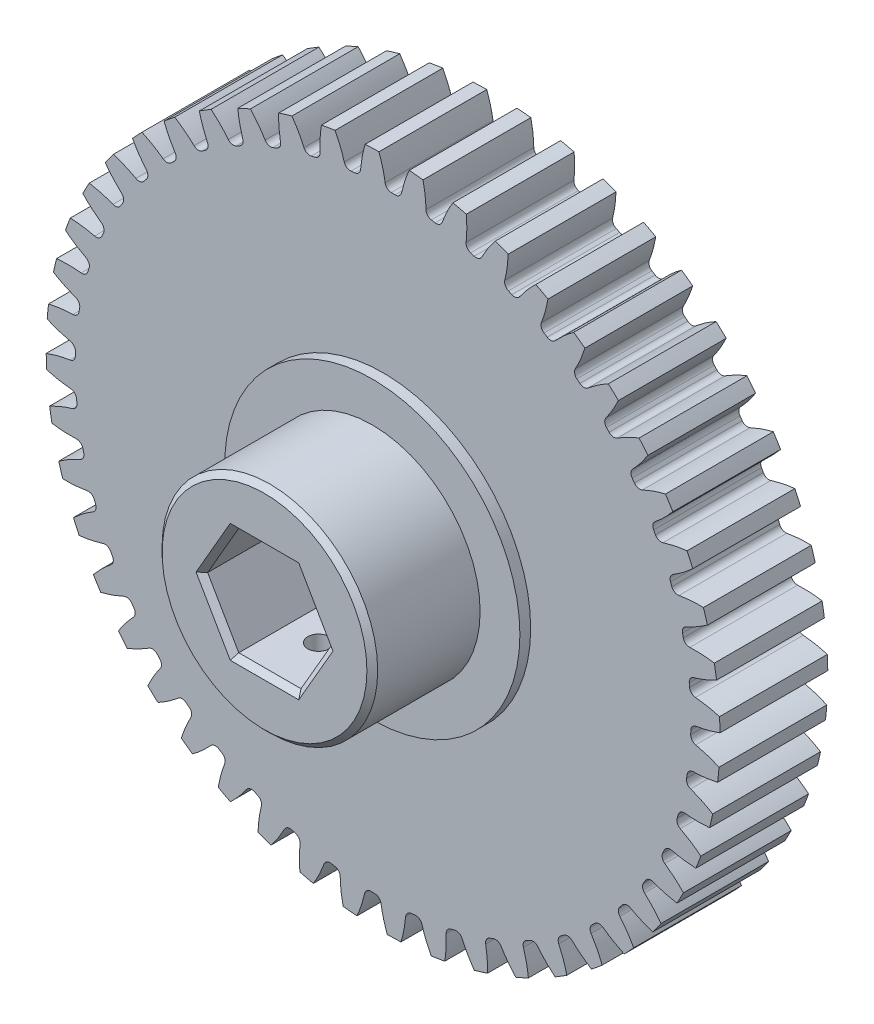
from build123d import *

# Parameters (mm, degrees)
SKETCH1_R                 = 39.6875
BOSS_EXTRUDE1_DEPTH       = 12.7
CUT_EXTRUDE1_DEPTH        = 58.545506449
FILLET1_R                 = 0.7480935
CIRPATTERN1_START         = -12.7
CIRPATTERN1_DEPTH         = 12.7
SKETCH6_R                 = 12.7
BOSS_EXTRUDE2_DEPTH       = 8.89
BOSS_EXTRUDE3_START       = 13.97
SKETCH7_R                 = 12.7
BOSS_EXTRUDE3_DEPTH       = 13.97
CUT_EXTRUDE3_DEPTH        = 12.7
M3X0_5_TAPPED_HOLE1_D     = 2.5
M3X0_5_TAPPED_HOLE1_DEPTH = 10.6700066
M3X0_5_TAPPED_HOLE1_TIP   = 0.751075774
CHAMFER1_SIZE             = 0.635
BOSS_EXTRUDE4_START       = 1.27
SKETCH11_R                = 17.3863
SKETCH11_R_2              = 12.7
BOSS_EXTRUDE4_DEPTH       = 1.27
SKETCH12_R                = 17.3863
SKETCH12_R_2              = 12.7
BOSS_EXTRUDE5_DEPTH       = 1.27


# Read off the part's stored shape, not the designer's step: CirPattern1
with BuildPart() as part:
    # Sketch1 → Boss-Extrude1 (new body)
    with BuildSketch(Plane.XY):
        Circle(SKETCH1_R)
    extrude(amount=-BOSS_EXTRUDE1_DEPTH)

    # Sketch4 → Cut-Extrude1 (cut, through all)
    with BuildSketch(Plane.XY):
        with BuildLine():
            Line((0.240718922, 36.88563963), (0.240718922, 36.262463534))
            ThreePointArc((0.240718922, 36.262463534), (1.186503463, 36.243846604), (2.131480605, 36.20056626))
            Line((2.131480605, 36.20056626), (2.172238367, 36.822408083))
            add(Edge.make_bspline(
                [(6.893954828, 44.735686784), (3.179844428, 41.34985308), (2.172238367, 36.822408083)],
                knots=[0, 0, 0, 1, 1, 1], degree=2))
            ThreePointArc((6.893954828, 44.735686784), (1.480992288, 45.23952859), (-3.953333536, 45.090791068))
            add(Edge.make_bspline(
                [(-3.953333536, 45.090791068), (-0.468620005, 41.469291718), (0.240718922, 36.88563963)],
                knots=[0, 0, 0, 1, 1, 1], degree=2))
        make_face()
    extrude(amount=-CUT_EXTRUDE1_DEPTH, mode=Mode.SUBTRACT)

    # Fillet1
    # the kernel refuses this fillet: 0.7480935 mm, written as the material it adds along each edge
    with BuildSketch(Plane(origin=(2.131480605, 36.20056626, 0), x_dir=(-0.9988052902028769, 0.0488670877252457, 0), z_dir=(0, 0, -1))) as fillet1_piece_1:
        with BuildLine():
            CenterArc((0.727260644, 0.748056652), FILLET1_R, 189.616112264, 79.815209924)
            Line((-0.010321469, 0.623090615), (-0.025073112, 0.620591294))
            ThreePointArc((-0.025073112, 0.620591294), (-0.020120552, 0.311297499), (-0.014959818, -0.000247809))
            Line((-0.014959818, -0.000247809), (0.000148499, -0.014961133))
            ThreePointArc((0.000148499, -0.014961133), (0.359917857, -0.013175709), (0.719687215, -0.014961133))
            Line((0.719687215, -0.014961133), (0.719835714, 0))
        make_face()
    extrude(amount=12.7)
    with BuildSketch(Plane(origin=(0.240718922, 36.262463534, 0), x_dir=(0, 1, 0), z_dir=(0, 0, -1))) as fillet1_piece_2:
        with BuildLine():
            CenterArc((0.735908652, 0.739550712), FILLET1_R, 181.51769315, 79.815209924)
            Line((-0.011922412, 0.719736973), (-0.026879033, 0.719340698))
            ThreePointArc((-0.026879033, 0.719340698), (-0.019135108, 0.359650261), (-0.01496154, -9.9318e-05))
            Line((-0.01496154, -9.9318e-05), (0, -0.01496187))
            ThreePointArc((0, -0.01496187), (0.311588048, -0.01496187), (0.620921445, -0.014791014))
            Line((0.620921445, -0.014791014), (0.623176097, 0))
        make_face()
    extrude(amount=12.7)

    # CirPattern1 outline → CirPattern1 (cut)
    with BuildSketch(Plane.XY.offset(CIRPATTERN1_START)):
        with BuildLine():
            ThreePointArc((-2.112500539, 39.631237651), (-3.890052234, 39.496394138), (-5.65975547, 39.28186381))
            add(Edge.make_bspline(
                [(-5.65975547, 39.28186381), (-4.986888308, 38.00730371), (-4.57588255, 36.601497994)],
                knots=[0.684219953, 0.684219953, 0.684219953, 1, 1, 1], degree=2))
            ThreePointArc((-4.57588255, 36.601497994), (-4.274892959, 36.189054339), (-3.779406036, 36.065777368))
            ThreePointArc((-3.779406036, 36.065777368), (-3.554418528, 36.088645251), (-3.329292785, 36.110109619))
            ThreePointArc((-3.329292785, 36.110109619), (-2.867376615, 36.327682491), (-2.652634149, 36.79092128))
            add(Edge.make_bspline(
                [(-2.652634149, 36.79092128), (-2.523784618, 38.249898059), (-2.112500539, 39.631237651)],
                knots=[0, 0, 0, 0.315780047, 0.315780047, 0.315780047], degree=2))
        make_face()
        with BuildLine():
            add(Edge.make_bspline(
                [(6.959943282, 36.223853275), (7.462013348, 37.599767913), (8.216800257, 38.827591347)],
                knots=[0, 0, 0, 0.315780047, 0.315780047, 0.315780047], degree=2))
            ThreePointArc((8.216800257, 38.827591347), (6.464917097, 39.157406747), (4.699990502, 39.408219263))
            add(Edge.make_bspline(
                [(4.699990502, 39.408219263), (5.020049844, 38.002937911), (5.053201627, 36.538657746)],
                knots=[0.684219953, 0.684219953, 0.684219953, 1, 1, 1], degree=2))
            ThreePointArc((5.053201627, 36.538657746), (5.237186973, 36.062365929), (5.683884161, 35.815048066))
            ThreePointArc((5.683884161, 35.815048066), (5.90712405, 35.778905693), (6.130134206, 35.741371851))
            ThreePointArc((6.130134206, 35.741371851), (6.632622967, 35.831978404), (6.959943282, 36.223853275))
        make_face()
        with BuildLine():
            add(Edge.make_bspline(
                [(11.628561638, 35.005498294), (12.305929324, 36.304108497), (13.214522043, 37.422908271)],
                knots=[0, 0, 0, 0.315780047, 0.315780047, 0.315780047], degree=2))
            ThreePointArc((13.214522043, 37.422908271), (11.520676035, 37.978568692), (9.803586234, 38.45760462))
            add(Edge.make_bspline(
                [(9.803586234, 38.45760462), (9.9374814, 37.022569518), (9.779222651, 35.566489297)],
                knots=[0.684219953, 0.684219953, 0.684219953, 1, 1, 1], degree=2))
            ThreePointArc((9.779222651, 35.566489297), (9.89946542, 35.070257316), (10.310059592, 34.766749609))
            ThreePointArc((10.310059592, 34.766749609), (10.526672107, 34.701777786), (10.742875231, 34.635456384))
            ThreePointArc((10.742875231, 34.635456384), (11.25289166, 34.659699841), (11.628561638, 35.005498294))
        make_face()
        with BuildLine():
            add(Edge.make_bspline(
                [(16.09821208, 33.188189531), (16.939287436, 34.38727572), (17.986139693, 35.377908858)],
                knots=[0, 0, 0, 0.315780047, 0.315780047, 0.315780047], degree=2))
            ThreePointArc((17.986139693, 35.377908858), (16.379313011, 36.149906796), (14.739439888, 36.8489697))
            add(Edge.make_bspline(
                [(14.739439888, 36.8489697), (14.684879895, 35.408734696), (14.337918464, 33.985768355)],
                knots=[0.684219953, 0.684219953, 0.684219953, 1, 1, 1], degree=2))
            ThreePointArc((14.337918464, 33.985768355), (14.392361268, 33.478086876), (14.759827045, 33.123582426))
            ThreePointArc((14.759827045, 33.123582426), (14.966105885, 33.03089284), (15.171802681, 32.936918656))
            ThreePointArc((15.171802681, 32.936918656), (15.680620254, 32.894384205), (16.09821208, 33.188189531))
        make_face()
        with BuildLine():
            add(Edge.make_bspline(
                [(20.29241765, 30.803021645), (21.282809645, 31.882067121), (22.450009507, 32.727583617)],
                knots=[0, 0, 0, 0.315780047, 0.315780047, 0.315780047], degree=2))
            ThreePointArc((22.450009507, 32.727583617), (20.9576954, 33.702709973), (19.423097638, 34.609838691))
            add(Edge.make_bspline(
                [(19.423097638, 34.609838691), (19.181016023, 33.189046607), (18.651288517, 31.823541494)],
                knots=[0.684219953, 0.684219953, 0.684219953, 1, 1, 1], degree=2))
            ThreePointArc((18.651288517, 31.823541494), (18.638999825, 31.313097089), (18.957049766, 30.913661565))
            ThreePointArc((18.957049766, 30.913661565), (19.149465443, 30.794840159), (19.341136382, 30.674821118))
            ThreePointArc((19.341136382, 30.674821118), (19.84004909, 30.566236534), (20.29241765, 30.803021645))
        make_face()
        with BuildLine():
            add(Edge.make_bspline(
                [(24.139414328, 27.890805518), (25.262177079, 28.831347515), (26.529753433, 29.517280346)],
                knots=[0, 0, 0, 0.315780047, 0.315780047, 0.315780047], degree=2))
            ThreePointArc((26.529753433, 29.517280346), (25.177485811, 30.678850439), (23.774420802, 31.778523747))
            add(Edge.make_bspline(
                [(23.774420802, 31.778523747), (23.348959648, 30.401484728), (22.645529852, 29.116805014)],
                knots=[0.684219953, 0.684219953, 0.684219953, 1, 1, 1], degree=2))
            ThreePointArc((22.645529852, 29.116805014), (22.566719928, 28.612331528), (22.829912108, 28.174799383))
            ThreePointArc((22.829912108, 28.174799383), (23.005172337, 28.031879225), (23.179537876, 27.887868886))
            ThreePointArc((23.179537876, 27.887868886), (23.660009185, 27.715092082), (24.139414328, 27.890805518))
        make_face()
        with BuildLine():
            add(Edge.make_bspline(
                [(27.573378934, 24.501369976), (28.80930166, 25.287315559), (30.155565923, 25.801928224)],
                knots=[0, 0, 0, 0.315780047, 0.315780047, 0.315780047], degree=2))
            ThreePointArc((30.155565923, 25.801928224), (28.966482459, 27.130067267), (27.718957035, 28.403469451))
            add(Edge.make_bspline(
                [(27.718957035, 28.403469451), (27.117396101, 27.093745016), (26.252299893, 25.911871929)],
                knots=[0.684219953, 0.684219953, 0.684219953, 1, 1, 1], degree=2))
            ThreePointArc((26.252299893, 25.911871929), (26.108317195, 25.422001043), (26.312148326, 24.953858572))
            ThreePointArc((26.312148326, 24.953858572), (26.467254355, 24.789285066), (26.621331051, 24.623747485))
            ThreePointArc((26.621331051, 24.623747485), (27.075139963, 24.389734721), (27.573378934, 24.501369976))
        make_face()
        with BuildLine():
            add(Edge.make_bspline(
                [(30.535555382, 20.6927092), (31.863491102, 21.310610622), (33.26540832, 21.645097957)],
                knots=[0, 0, 0, 0.315780047, 0.315780047, 0.315780047], degree=2))
            ThreePointArc((33.26540832, 21.645097957), (32.25985456, 23.117081123), (31.189214228, 24.542423918))
            add(Edge.make_bspline(
                [(31.189214228, 24.542423918), (30.421846388, 23.322423816), (29.409885805, 22.26357953)],
                knots=[0.684219953, 0.684219953, 0.684219953, 1, 1, 1], degree=2))
            ThreePointArc((29.409885805, 22.26357953), (29.203193917, 21.796693071), (29.34417639, 21.305950323))
            ThreePointArc((29.34417639, 21.305950323), (29.476474312, 21.122539366), (29.607625871, 20.938306938))
            ThreePointArc((29.607625871, 20.938306938), (30.02700759, 20.647062236), (30.535555382, 20.6927092))
        make_face()
        with BuildLine():
            add(Edge.make_bspline(
                [(32.975260012, 16.529990433), (34.372487377, 16.96927523), (35.806070357, 17.117914063)],
                knots=[0, 0, 0, 0.315780047, 0.315780047, 0.315780047], degree=2))
            ThreePointArc((35.806070357, 17.117914063), (35.001251607, 18.708555312), (34.125815318, 20.261450707))
            add(Edge.make_bspline(
                [(34.125815318, 20.261450707), (33.205770449, 19.152049477), (32.064260416, 18.234351113)],
                knots=[0.684219953, 0.684219953, 0.684219953, 1, 1, 1], degree=2))
            ThreePointArc((32.064260416, 18.234351113), (31.798395894, 17.798437637), (31.87411746, 17.293491356))
            ThreePointArc((31.87411746, 17.293491356), (31.981343622, 17.094381162), (32.087326004, 16.894606154))
            ThreePointArc((32.087326004, 16.894606154), (32.465104792, 16.551112792), (32.975260012, 16.529990433))
        make_face()
        with BuildLine():
            add(Edge.make_bspline(
                [(34.8507488, 12.084438946), (36.293360863, 12.337590834), (37.734080602, 12.297837913)],
                knots=[0, 0, 0, 0.315780047, 0.315780047, 0.315780047], degree=2))
            ThreePointArc((37.734080602, 12.297837913), (37.143767534, 13.979920933), (36.478514247, 15.633798458))
            add(Edge.make_bspline(
                [(36.478514247, 15.633798458), (35.421534571, 14.653978263), (34.170006641, 13.893127893)],
                knots=[0.684219953, 0.684219953, 0.684219953, 1, 1, 1], degree=2))
            ThreePointArc((34.170006641, 13.893127893), (33.849518502, 13.495646001), (33.858683544, 12.985135958))
            ThreePointArc((33.858683544, 12.985135958), (33.939003275, 12.773733356), (34.018003092, 12.561833974))
            ThreePointArc((34.018003092, 12.561833974), (34.34771505, 12.171969219), (34.8507488, 12.084438946))
        make_face()
        with BuildLine():
            add(Edge.make_bspline(
                [(36.129931613, 7.432119359), (37.593244882, 7.494806837), (39.016450267, 7.267342347)],
                knots=[0, 0, 0, 0.315780047, 0.315780047, 0.315780047], degree=2))
            ThreePointArc((39.016450267, 7.267342347), (38.6507433, 9.01208623), (38.207055683, 10.738647582))
            add(Edge.make_bspline(
                [(38.207055683, 10.738647582), (37.031226416, 9.905173417), (35.69109458, 9.314189403)],
                knots=[0.684219953, 0.684219953, 0.684219953, 1, 1, 1], degree=2))
            ThreePointArc((35.69109458, 9.314189403), (35.321466463, 8.96194012), (35.263918164, 8.454601283))
            ThreePointArc((35.263918164, 8.454601283), (35.315957172, 8.234523431), (35.366622715, 8.014125333))
            ThreePointArc((35.366622715, 8.014125333), (35.642626379, 7.584559878), (36.129931613, 7.432119359))
        make_face()
        with BuildLine():
            add(Edge.make_bspline(
                [(36.79092128, 2.652634149), (38.249898059, 2.523784618), (39.631237651, 2.112500539)],
                knots=[0, 0, 0, 0.315780047, 0.315780047, 0.315780047], degree=2))
            ThreePointArc((39.631237651, 2.112500539), (39.496394132, 3.890052234), (39.281863803, 5.659755469))
            add(Edge.make_bspline(
                [(39.281863803, 5.659755469), (38.00730371, 4.986888308), (36.601497994, 4.57588255)],
                knots=[0.684219953, 0.684219953, 0.684219953, 1, 1, 1], degree=2))
            ThreePointArc((36.601497994, 4.57588255), (36.189054339, 4.274892959), (36.065777368, 3.779406036))
            ThreePointArc((36.065777368, 3.779406036), (36.088645251, 3.554418528), (36.110109619, 3.329292785))
            ThreePointArc((36.110109619, 3.329292785), (36.327682491, 2.867376615), (36.79092128, 2.652634149))
        make_face()
        with BuildLine():
            add(Edge.make_bspline(
                [(36.822408083, -2.172238367), (38.252084875, -2.490420255), (39.56792357, -3.07848674)],
                knots=[0, 0, 0, 0.315780047, 0.315780047, 0.315780047], degree=2))
            ThreePointArc((39.56792357, -3.07848674), (39.666250711, -1.298541635), (39.684548343, 0.484023371))
            add(Edge.make_bspline(
                [(39.684548343, 0.484023371), (38.3330655, -0.016723843), (36.88563963, -0.240718922)],
                knots=[0.684219953, 0.684219953, 0.684219953, 1, 1, 1], degree=2))
            ThreePointArc((36.88563963, -0.240718922), (36.437437463, -0.485298806), (36.250541122, -0.960455895))
            ThreePointArc((36.250541122, -0.960455895), (36.243846604, -1.186503463), (36.235742535, -1.412504886))
            ThreePointArc((36.235742535, -1.412504886), (36.391161882, -1.898868257), (36.822408083, -2.172238367))
        make_face()
        with BuildLine():
            add(Edge.make_bspline(
                [(36.223853275, -6.959943282), (37.599767913, -7.462013348), (38.827591347, -8.216800257)],
                knots=[0, 0, 0, 0.315780047, 0.315780047, 0.315780047], degree=2))
            ThreePointArc((38.827591347, -8.216800257), (39.157406742, -6.464917096), (39.408219258, -4.699990501))
            add(Edge.make_bspline(
                [(39.408219258, -4.699990501), (38.002937911, -5.020049844), (36.538657746, -5.053201627)],
                knots=[0.684219953, 0.684219953, 0.684219953, 1, 1, 1], degree=2))
            ThreePointArc((36.538657746, -5.053201627), (36.062365929, -5.237186973), (35.815048066, -5.683884161))
            ThreePointArc((35.815048066, -5.683884161), (35.778905693, -5.90712405), (35.741371851, -6.130134206))
            ThreePointArc((35.741371851, -6.130134206), (35.831978404, -6.632622967), (36.223853275, -6.959943282))
        make_face()
        with BuildLine():
            add(Edge.make_bspline(
                [(35.005498294, -11.628561638), (36.304108497, -12.305929324), (37.422908271, -13.214522043)],
                knots=[0, 0, 0, 0.315780047, 0.315780047, 0.315780047], degree=2))
            ThreePointArc((37.422908271, -13.214522043), (37.978568688, -11.520676033), (38.457604616, -9.803586233))
            add(Edge.make_bspline(
                [(38.457604616, -9.803586233), (37.022569518, -9.9374814), (35.566489297, -9.779222651)],
                knots=[0.684219953, 0.684219953, 0.684219953, 1, 1, 1], degree=2))
            ThreePointArc((35.566489297, -9.779222651), (35.070257316, -9.89946542), (34.766749609, -10.310059592))
            ThreePointArc((34.766749609, -10.310059592), (34.701777786, -10.526672107), (34.635456384, -10.742875231))
            ThreePointArc((34.635456384, -10.742875231), (34.659699841, -11.25289166), (35.005498294, -11.628561638))
        make_face()
        with BuildLine():
            add(Edge.make_bspline(
                [(33.188189531, -16.09821208), (34.38727572, -16.939287436), (35.377908858, -17.986139693)],
                knots=[0, 0, 0, 0.315780047, 0.315780047, 0.315780047], degree=2))
            ThreePointArc((35.377908858, -17.986139693), (36.149906794, -16.37931301), (36.848969696, -14.739439886))
            add(Edge.make_bspline(
                [(36.848969696, -14.739439886), (35.408734696, -14.684879895), (33.985768355, -14.337918464)],
                knots=[0.684219953, 0.684219953, 0.684219953, 1, 1, 1], degree=2))
            ThreePointArc((33.985768355, -14.337918464), (33.478086876, -14.392361268), (33.123582426, -14.759827045))
            ThreePointArc((33.123582426, -14.759827045), (33.03089284, -14.966105885), (32.936918656, -15.171802681))
            ThreePointArc((32.936918656, -15.171802681), (32.894384205, -15.680620254), (33.188189531, -16.09821208))
        make_face()
        with BuildLine():
            add(Edge.make_bspline(
                [(30.803021645, -20.29241765), (31.882067121, -21.282809645), (32.727583617, -22.450009507)],
                knots=[0, 0, 0, 0.315780047, 0.315780047, 0.315780047], degree=2))
            ThreePointArc((32.727583617, -22.450009507), (33.702709972, -20.957695399), (34.609838689, -19.423097637))
            add(Edge.make_bspline(
                [(34.609838689, -19.423097637), (33.189046607, -19.181016023), (31.823541494, -18.651288517)],
                knots=[0.684219953, 0.684219953, 0.684219953, 1, 1, 1], degree=2))
            ThreePointArc((31.823541494, -18.651288517), (31.313097089, -18.638999825), (30.913661565, -18.957049766))
            ThreePointArc((30.913661565, -18.957049766), (30.794840159, -19.149465443), (30.674821118, -19.341136382))
            ThreePointArc((30.674821118, -19.341136382), (30.566236534, -19.84004909), (30.803021645, -20.29241765))
        make_face()
        with BuildLine():
            add(Edge.make_bspline(
                [(27.890805518, -24.139414328), (28.831347515, -25.262177079), (29.517280346, -26.529753433)],
                knots=[0, 0, 0, 0.315780047, 0.315780047, 0.315780047], degree=2))
            ThreePointArc((29.517280346, -26.529753433), (30.678850438, -25.17748581), (31.778523746, -23.774420801))
            add(Edge.make_bspline(
                [(31.778523746, -23.774420801), (30.401484728, -23.348959648), (29.116805014, -22.645529852)],
                knots=[0.684219953, 0.684219953, 0.684219953, 1, 1, 1], degree=2))
            ThreePointArc((29.116805014, -22.645529852), (28.612331528, -22.566719928), (28.174799383, -22.829912108))
            ThreePointArc((28.174799383, -22.829912108), (28.031879225, -23.005172337), (27.887868886, -23.179537876))
            ThreePointArc((27.887868886, -23.179537876), (27.715092082, -23.660009185), (27.890805518, -24.139414328))
        make_face()
        with BuildLine():
            add(Edge.make_bspline(
                [(24.501369976, -27.573378934), (25.287315559, -28.80930166), (25.801928224, -30.155565923)],
                knots=[0, 0, 0, 0.315780047, 0.315780047, 0.315780047], degree=2))
            ThreePointArc((25.801928224, -30.155565923), (27.130067267, -28.966482459), (28.403469451, -27.718957035))
            add(Edge.make_bspline(
                [(28.403469451, -27.718957035), (27.093745016, -27.117396101), (25.911871929, -26.252299893)],
                knots=[0.684219953, 0.684219953, 0.684219953, 1, 1, 1], degree=2))
            ThreePointArc((25.911871929, -26.252299893), (25.422001043, -26.108317195), (24.953858572, -26.312148326))
            ThreePointArc((24.953858572, -26.312148326), (24.789285066, -26.467254355), (24.623747485, -26.621331051))
            ThreePointArc((24.623747485, -26.621331051), (24.389734721, -27.075139963), (24.501369976, -27.573378934))
        make_face()
        with BuildLine():
            add(Edge.make_bspline(
                [(20.6927092, -30.535555382), (21.310610622, -31.863491102), (21.645097957, -33.26540832)],
                knots=[0, 0, 0, 0.315780047, 0.315780047, 0.315780047], degree=2))
            ThreePointArc((21.645097957, -33.26540832), (23.117081124, -32.259854561), (24.542423918, -31.189214229))
            add(Edge.make_bspline(
                [(24.542423918, -31.189214229), (23.322423816, -30.421846388), (22.26357953, -29.409885805)],
                knots=[0.684219953, 0.684219953, 0.684219953, 1, 1, 1], degree=2))
            ThreePointArc((22.26357953, -29.409885805), (21.796693071, -29.203193917), (21.305950323, -29.34417639))
            ThreePointArc((21.305950323, -29.34417639), (21.122539366, -29.476474312), (20.938306938, -29.607625871))
            ThreePointArc((20.938306938, -29.607625871), (20.647062236, -30.02700759), (20.6927092, -30.535555382))
        make_face()
        with BuildLine():
            add(Edge.make_bspline(
                [(16.529990433, -32.975260012), (16.96927523, -34.372487377), (17.117914063, -35.806070357)],
                knots=[0, 0, 0, 0.315780047, 0.315780047, 0.315780047], degree=2))
            ThreePointArc((17.117914063, -35.806070357), (18.708555313, -35.001251608), (20.261450708, -34.12581532))
            add(Edge.make_bspline(
                [(20.261450708, -34.12581532), (19.152049477, -33.205770449), (18.234351113, -32.064260416)],
                knots=[0.684219953, 0.684219953, 0.684219953, 1, 1, 1], degree=2))
            ThreePointArc((18.234351113, -32.064260416), (17.798437637, -31.798395894), (17.293491356, -31.87411746))
            ThreePointArc((17.293491356, -31.87411746), (17.094381162, -31.981343622), (16.894606154, -32.087326004))
            ThreePointArc((16.894606154, -32.087326004), (16.551112792, -32.465104792), (16.529990433, -32.975260012))
        make_face()
        with BuildLine():
            add(Edge.make_bspline(
                [(12.084438946, -34.8507488), (12.337590834, -36.293360863), (12.297837913, -37.734080602)],
                knots=[0, 0, 0, 0.315780047, 0.315780047, 0.315780047], degree=2))
            ThreePointArc((12.297837913, -37.734080602), (13.979920934, -37.143767536), (15.633798459, -36.478514249))
            add(Edge.make_bspline(
                [(15.633798459, -36.478514249), (14.653978263, -35.421534571), (13.893127893, -34.170006641)],
                knots=[0.684219953, 0.684219953, 0.684219953, 1, 1, 1], degree=2))
            ThreePointArc((13.893127893, -34.170006641), (13.495646001, -33.849518502), (12.985135958, -33.858683544))
            ThreePointArc((12.985135958, -33.858683544), (12.773733356, -33.939003275), (12.561833974, -34.018003092))
            ThreePointArc((12.561833974, -34.018003092), (12.171969219, -34.34771505), (12.084438946, -34.8507488))
        make_face()
        with BuildLine():
            add(Edge.make_bspline(
                [(7.432119359, -36.129931613), (7.494806837, -37.593244882), (7.267342347, -39.016450267)],
                knots=[0, 0, 0, 0.315780047, 0.315780047, 0.315780047], degree=2))
            ThreePointArc((7.267342347, -39.016450267), (9.012086231, -38.650743303), (10.738647583, -38.207055686))
            add(Edge.make_bspline(
                [(10.738647583, -38.207055686), (9.905173417, -37.031226416), (9.314189403, -35.69109458)],
                knots=[0.684219953, 0.684219953, 0.684219953, 1, 1, 1], degree=2))
            ThreePointArc((9.314189403, -35.69109458), (8.96194012, -35.321466463), (8.454601283, -35.263918164))
            ThreePointArc((8.454601283, -35.263918164), (8.234523431, -35.315957172), (8.014125333, -35.366622715))
            ThreePointArc((8.014125333, -35.366622715), (7.584559878, -35.642626379), (7.432119359, -36.129931613))
        make_face()
        with BuildLine():
            add(Edge.make_bspline(
                [(2.652634149, -36.79092128), (2.523784618, -38.249898059), (2.112500539, -39.631237651)],
                knots=[0, 0, 0, 0.315780047, 0.315780047, 0.315780047], degree=2))
            ThreePointArc((2.112500539, -39.631237651), (3.890052234, -39.496394137), (5.65975547, -39.281863808))
            add(Edge.make_bspline(
                [(5.65975547, -39.281863808), (4.986888308, -38.00730371), (4.57588255, -36.601497994)],
                knots=[0.684219953, 0.684219953, 0.684219953, 1, 1, 1], degree=2))
            ThreePointArc((4.57588255, -36.601497994), (4.274892959, -36.189054339), (3.779406036, -36.065777368))
            ThreePointArc((3.779406036, -36.065777368), (3.554418528, -36.088645251), (3.329292785, -36.110109619))
            ThreePointArc((3.329292785, -36.110109619), (2.867376615, -36.327682491), (2.652634149, -36.79092128))
        make_face()
        with BuildLine():
            add(Edge.make_bspline(
                [(-2.172238367, -36.822408083), (-2.490420255, -38.252084875), (-3.07848674, -39.56792357)],
                knots=[0, 0, 0, 0.315780047, 0.315780047, 0.315780047], degree=2))
            ThreePointArc((-3.07848674, -39.56792357), (-1.298541635, -39.666250716), (0.484023371, -39.684548348))
            add(Edge.make_bspline(
                [(0.484023371, -39.684548348), (-0.016723843, -38.3330655), (-0.240718922, -36.88563963)],
                knots=[0.684219953, 0.684219953, 0.684219953, 1, 1, 1], degree=2))
            ThreePointArc((-0.240718922, -36.88563963), (-0.485298806, -36.437437463), (-0.960455895, -36.250541122))
            ThreePointArc((-0.960455895, -36.250541122), (-1.186503463, -36.243846604), (-1.412504886, -36.235742535))
            ThreePointArc((-1.412504886, -36.235742535), (-1.898868257, -36.391161882), (-2.172238367, -36.822408083))
        make_face()
        with BuildLine():
            add(Edge.make_bspline(
                [(-6.959943282, -36.223853275), (-7.462013348, -37.599767913), (-8.216800257, -38.827591347)],
                knots=[0, 0, 0, 0.315780047, 0.315780047, 0.315780047], degree=2))
            ThreePointArc((-8.216800257, -38.827591347), (-6.464917097, -39.157406748), (-4.699990502, -39.408219264))
            add(Edge.make_bspline(
                [(-4.699990502, -39.408219264), (-5.020049844, -38.002937911), (-5.053201627, -36.538657746)],
                knots=[0.684219953, 0.684219953, 0.684219953, 1, 1, 1], degree=2))
            ThreePointArc((-5.053201627, -36.538657746), (-5.237186973, -36.062365929), (-5.683884161, -35.815048066))
            ThreePointArc((-5.683884161, -35.815048066), (-5.90712405, -35.778905693), (-6.130134206, -35.741371851))
            ThreePointArc((-6.130134206, -35.741371851), (-6.632622967, -35.831978404), (-6.959943282, -36.223853275))
        make_face()
        with BuildLine():
            add(Edge.make_bspline(
                [(-11.628561638, -35.005498294), (-12.305929324, -36.304108497), (-13.214522043, -37.422908271)],
                knots=[0, 0, 0, 0.315780047, 0.315780047, 0.315780047], degree=2))
            ThreePointArc((-13.214522043, -37.422908271), (-11.520676035, -37.978568694), (-9.803586235, -38.457604622))
            add(Edge.make_bspline(
                [(-9.803586235, -38.457604622), (-9.9374814, -37.022569518), (-9.779222651, -35.566489297)],
                knots=[0.684219953, 0.684219953, 0.684219953, 1, 1, 1], degree=2))
            ThreePointArc((-9.779222651, -35.566489297), (-9.89946542, -35.070257316), (-10.310059592, -34.766749609))
            ThreePointArc((-10.310059592, -34.766749609), (-10.526672107, -34.701777786), (-10.742875231, -34.635456384))
            ThreePointArc((-10.742875231, -34.635456384), (-11.25289166, -34.659699841), (-11.628561638, -35.005498294))
        make_face()
        with BuildLine():
            add(Edge.make_bspline(
                [(-16.09821208, -33.188189531), (-16.939287436, -34.38727572), (-17.986139693, -35.377908858)],
                knots=[0, 0, 0, 0.315780047, 0.315780047, 0.315780047], degree=2))
            ThreePointArc((-17.986139693, -35.377908858), (-16.379313013, -36.1499068), (-14.739439889, -36.848969703))
            add(Edge.make_bspline(
                [(-14.739439889, -36.848969703), (-14.684879895, -35.408734696), (-14.337918464, -33.985768355)],
                knots=[0.684219953, 0.684219953, 0.684219953, 1, 1, 1], degree=2))
            ThreePointArc((-14.337918464, -33.985768355), (-14.392361268, -33.478086876), (-14.759827045, -33.123582426))
            ThreePointArc((-14.759827045, -33.123582426), (-14.966105885, -33.03089284), (-15.171802681, -32.936918656))
            ThreePointArc((-15.171802681, -32.936918656), (-15.680620254, -32.894384205), (-16.09821208, -33.188189531))
        make_face()
        with BuildLine():
            add(Edge.make_bspline(
                [(-20.29241765, -30.803021645), (-21.282809645, -31.882067121), (-22.450009507, -32.727583617)],
                knots=[0, 0, 0, 0.315780047, 0.315780047, 0.315780047], degree=2))
            ThreePointArc((-22.450009507, -32.727583617), (-20.957695403, -33.702709978), (-19.42309764, -34.609838695))
            add(Edge.make_bspline(
                [(-19.42309764, -34.609838695), (-19.181016023, -33.189046607), (-18.651288517, -31.823541494)],
                knots=[0.684219953, 0.684219953, 0.684219953, 1, 1, 1], degree=2))
            ThreePointArc((-18.651288517, -31.823541494), (-18.638999825, -31.313097089), (-18.957049766, -30.913661565))
            ThreePointArc((-18.957049766, -30.913661565), (-19.149465443, -30.794840159), (-19.341136382, -30.674821118))
            ThreePointArc((-19.341136382, -30.674821118), (-19.84004909, -30.566236534), (-20.29241765, -30.803021645))
        make_face()
        with BuildLine():
            add(Edge.make_bspline(
                [(-24.139414328, -27.890805518), (-25.262177079, -28.831347515), (-26.529753433, -29.517280346)],
                knots=[0, 0, 0, 0.315780047, 0.315780047, 0.315780047], degree=2))
            ThreePointArc((-26.529753433, -29.517280346), (-25.177485815, -30.678850444), (-23.774420806, -31.778523752))
            add(Edge.make_bspline(
                [(-23.774420806, -31.778523752), (-23.348959648, -30.401484728), (-22.645529852, -29.116805014)],
                knots=[0.684219953, 0.684219953, 0.684219953, 1, 1, 1], degree=2))
            ThreePointArc((-22.645529852, -29.116805014), (-22.566719928, -28.612331528), (-22.829912108, -28.174799383))
            ThreePointArc((-22.829912108, -28.174799383), (-23.005172337, -28.031879225), (-23.179537876, -27.887868886))
            ThreePointArc((-23.179537876, -27.887868886), (-23.660009185, -27.715092082), (-24.139414328, -27.890805518))
        make_face()
        with BuildLine():
            add(Edge.make_bspline(
                [(-27.573378934, -24.501369976), (-28.80930166, -25.287315559), (-30.155565923, -25.801928224)],
                knots=[0, 0, 0, 0.315780047, 0.315780047, 0.315780047], degree=2))
            ThreePointArc((-30.155565923, -25.801928224), (-28.966482464, -27.130067272), (-27.71895704, -28.403469456))
            add(Edge.make_bspline(
                [(-27.71895704, -28.403469456), (-27.117396101, -27.093745016), (-26.252299893, -25.911871929)],
                knots=[0.684219953, 0.684219953, 0.684219953, 1, 1, 1], degree=2))
            ThreePointArc((-26.252299893, -25.911871929), (-26.108317195, -25.422001043), (-26.312148326, -24.953858572))
            ThreePointArc((-26.312148326, -24.953858572), (-26.467254355, -24.789285066), (-26.621331051, -24.623747485))
            ThreePointArc((-26.621331051, -24.623747485), (-27.075139963, -24.389734721), (-27.573378934, -24.501369976))
        make_face()
        with BuildLine():
            add(Edge.make_bspline(
                [(-30.535555382, -20.6927092), (-31.863491102, -21.310610622), (-33.26540832, -21.645097957)],
                knots=[0, 0, 0, 0.315780047, 0.315780047, 0.315780047], degree=2))
            ThreePointArc((-33.26540832, -21.645097957), (-32.259854567, -23.117081128), (-31.189214234, -24.542423923))
            add(Edge.make_bspline(
                [(-31.189214234, -24.542423923), (-30.421846388, -23.322423816), (-29.409885805, -22.26357953)],
                knots=[0.684219953, 0.684219953, 0.684219953, 1, 1, 1], degree=2))
            ThreePointArc((-29.409885805, -22.26357953), (-29.203193917, -21.796693071), (-29.34417639, -21.305950323))
            ThreePointArc((-29.34417639, -21.305950323), (-29.476474312, -21.122539366), (-29.607625871, -20.938306938))
            ThreePointArc((-29.607625871, -20.938306938), (-30.02700759, -20.647062236), (-30.535555382, -20.6927092))
        make_face()
        with BuildLine():
            add(Edge.make_bspline(
                [(-32.975260012, -16.529990433), (-34.372487377, -16.96927523), (-35.806070357, -17.117914063)],
                knots=[0, 0, 0, 0.315780047, 0.315780047, 0.315780047], degree=2))
            ThreePointArc((-35.806070357, -17.117914063), (-35.001251615, -18.708555316), (-34.125815326, -20.261450712))
            add(Edge.make_bspline(
                [(-34.125815326, -20.261450712), (-33.205770449, -19.152049477), (-32.064260416, -18.234351113)],
                knots=[0.684219953, 0.684219953, 0.684219953, 1, 1, 1], degree=2))
            ThreePointArc((-32.064260416, -18.234351113), (-31.798395894, -17.798437637), (-31.87411746, -17.293491356))
            ThreePointArc((-31.87411746, -17.293491356), (-31.981343622, -17.094381162), (-32.087326004, -16.894606154))
            ThreePointArc((-32.087326004, -16.894606154), (-32.465104792, -16.551112792), (-32.975260012, -16.529990433))
        make_face()
        with BuildLine():
            add(Edge.make_bspline(
                [(-34.8507488, -12.084438946), (-36.293360863, -12.337590834), (-37.734080602, -12.297837913)],
                knots=[0, 0, 0, 0.315780047, 0.315780047, 0.315780047], degree=2))
            ThreePointArc((-37.734080602, -12.297837913), (-37.143767543, -13.979920936), (-36.478514256, -15.633798461))
            add(Edge.make_bspline(
                [(-36.478514256, -15.633798461), (-35.421534571, -14.653978263), (-34.170006641, -13.893127893)],
                knots=[0.684219953, 0.684219953, 0.684219953, 1, 1, 1], degree=2))
            ThreePointArc((-34.170006641, -13.893127893), (-33.849518502, -13.495646001), (-33.858683544, -12.985135958))
            ThreePointArc((-33.858683544, -12.985135958), (-33.939003275, -12.773733356), (-34.018003092, -12.561833974))
            ThreePointArc((-34.018003092, -12.561833974), (-34.34771505, -12.171969219), (-34.8507488, -12.084438946))
        make_face()
        with BuildLine():
            add(Edge.make_bspline(
                [(-36.129931613, -7.432119359), (-37.593244882, -7.494806837), (-39.016450267, -7.267342347)],
                knots=[0, 0, 0, 0.315780047, 0.315780047, 0.315780047], degree=2))
            ThreePointArc((-39.016450267, -7.267342347), (-38.65074331, -9.012086233), (-38.207055693, -10.738647585))
            add(Edge.make_bspline(
                [(-38.207055693, -10.738647585), (-37.031226416, -9.905173417), (-35.69109458, -9.314189403)],
                knots=[0.684219953, 0.684219953, 0.684219953, 1, 1, 1], degree=2))
            ThreePointArc((-35.69109458, -9.314189403), (-35.321466463, -8.96194012), (-35.263918164, -8.454601283))
            ThreePointArc((-35.263918164, -8.454601283), (-35.315957172, -8.234523431), (-35.366622715, -8.014125333))
            ThreePointArc((-35.366622715, -8.014125333), (-35.642626379, -7.584559878), (-36.129931613, -7.432119359))
        make_face()
        with BuildLine():
            add(Edge.make_bspline(
                [(-36.79092128, -2.652634149), (-38.249898059, -2.523784618), (-39.631237651, -2.112500539)],
                knots=[0, 0, 0, 0.315780047, 0.315780047, 0.315780047], degree=2))
            ThreePointArc((-39.631237651, -2.112500539), (-39.496394143, -3.890052235), (-39.281863814, -5.659755471))
            add(Edge.make_bspline(
                [(-39.281863814, -5.659755471), (-38.00730371, -4.986888308), (-36.601497994, -4.57588255)],
                knots=[0.684219953, 0.684219953, 0.684219953, 1, 1, 1], degree=2))
            ThreePointArc((-36.601497994, -4.57588255), (-36.189054339, -4.274892959), (-36.065777368, -3.779406036))
            ThreePointArc((-36.065777368, -3.779406036), (-36.088645251, -3.554418528), (-36.110109619, -3.329292785))
            ThreePointArc((-36.110109619, -3.329292785), (-36.327682491, -2.867376615), (-36.79092128, -2.652634149))
        make_face()
        with BuildLine():
            add(Edge.make_bspline(
                [(-36.822408083, 2.172238367), (-38.252084875, 2.490420255), (-39.56792357, 3.07848674)],
                knots=[0, 0, 0, 0.315780047, 0.315780047, 0.315780047], degree=2))
            ThreePointArc((-39.56792357, 3.07848674), (-39.666250722, 1.298541635), (-39.684548354, -0.484023371))
            add(Edge.make_bspline(
                [(-39.684548354, -0.484023371), (-38.3330655, 0.016723843), (-36.88563963, 0.240718922)],
                knots=[0.684219953, 0.684219953, 0.684219953, 1, 1, 1], degree=2))
            ThreePointArc((-36.88563963, 0.240718922), (-36.437437463, 0.485298806), (-36.250541122, 0.960455895))
            ThreePointArc((-36.250541122, 0.960455895), (-36.243846604, 1.186503463), (-36.235742535, 1.412504886))
            ThreePointArc((-36.235742535, 1.412504886), (-36.391161882, 1.898868257), (-36.822408083, 2.172238367))
        make_face()
        with BuildLine():
            add(Edge.make_bspline(
                [(-36.223853275, 6.959943282), (-37.599767913, 7.462013348), (-38.827591347, 8.216800257)],
                knots=[0, 0, 0, 0.315780047, 0.315780047, 0.315780047], degree=2))
            ThreePointArc((-38.827591347, 8.216800257), (-39.157406753, 6.464917098), (-39.408219269, 4.699990503))
            add(Edge.make_bspline(
                [(-39.408219269, 4.699990503), (-38.002937911, 5.020049844), (-36.538657746, 5.053201627)],
                knots=[0.684219953, 0.684219953, 0.684219953, 1, 1, 1], degree=2))
            ThreePointArc((-36.538657746, 5.053201627), (-36.062365929, 5.237186973), (-35.815048066, 5.683884161))
            ThreePointArc((-35.815048066, 5.683884161), (-35.778905693, 5.90712405), (-35.741371851, 6.130134206))
            ThreePointArc((-35.741371851, 6.130134206), (-35.831978404, 6.632622967), (-36.223853275, 6.959943282))
        make_face()
        with BuildLine():
            add(Edge.make_bspline(
                [(-35.005498294, 11.628561638), (-36.304108497, 12.305929324), (-37.422908271, 13.214522043)],
                knots=[0, 0, 0, 0.315780047, 0.315780047, 0.315780047], degree=2))
            ThreePointArc((-37.422908271, 13.214522043), (-37.978568698, 11.520676036), (-38.457604626, 9.803586236))
            add(Edge.make_bspline(
                [(-38.457604626, 9.803586236), (-37.022569518, 9.9374814), (-35.566489297, 9.779222651)],
                knots=[0.684219953, 0.684219953, 0.684219953, 1, 1, 1], degree=2))
            ThreePointArc((-35.566489297, 9.779222651), (-35.070257316, 9.89946542), (-34.766749609, 10.310059592))
            ThreePointArc((-34.766749609, 10.310059592), (-34.701777786, 10.526672107), (-34.635456384, 10.742875231))
            ThreePointArc((-34.635456384, 10.742875231), (-34.659699841, 11.25289166), (-35.005498294, 11.628561638))
        make_face()
        with BuildLine():
            add(Edge.make_bspline(
                [(-33.188189531, 16.09821208), (-34.38727572, 16.939287436), (-35.377908858, 17.986139693)],
                knots=[0, 0, 0, 0.315780047, 0.315780047, 0.315780047], degree=2))
            ThreePointArc((-35.377908858, 17.986139693), (-36.149906803, 16.379313014), (-36.848969706, 14.73943989))
            add(Edge.make_bspline(
                [(-36.848969706, 14.73943989), (-35.408734696, 14.684879895), (-33.985768355, 14.337918464)],
                knots=[0.684219953, 0.684219953, 0.684219953, 1, 1, 1], degree=2))
            ThreePointArc((-33.985768355, 14.337918464), (-33.478086876, 14.392361268), (-33.123582426, 14.759827045))
            ThreePointArc((-33.123582426, 14.759827045), (-33.03089284, 14.966105885), (-32.936918656, 15.171802681))
            ThreePointArc((-32.936918656, 15.171802681), (-32.894384205, 15.680620254), (-33.188189531, 16.09821208))
        make_face()
        with BuildLine():
            add(Edge.make_bspline(
                [(-30.803021645, 20.29241765), (-31.882067121, 21.282809645), (-32.727583617, 22.450009507)],
                knots=[0, 0, 0, 0.315780047, 0.315780047, 0.315780047], degree=2))
            ThreePointArc((-32.727583617, 22.450009507), (-33.70270998, 20.957695404), (-34.609838697, 19.423097641))
            add(Edge.make_bspline(
                [(-34.609838697, 19.423097641), (-33.189046607, 19.181016023), (-31.823541494, 18.651288517)],
                knots=[0.684219953, 0.684219953, 0.684219953, 1, 1, 1], degree=2))
            ThreePointArc((-31.823541494, 18.651288517), (-31.313097089, 18.638999825), (-30.913661565, 18.957049766))
            ThreePointArc((-30.913661565, 18.957049766), (-30.794840159, 19.149465443), (-30.674821118, 19.341136382))
            ThreePointArc((-30.674821118, 19.341136382), (-30.566236534, 19.84004909), (-30.803021645, 20.29241765))
        make_face()
        with BuildLine():
            add(Edge.make_bspline(
                [(-27.890805518, 24.139414328), (-28.831347515, 25.262177079), (-29.517280346, 26.529753433)],
                knots=[0, 0, 0, 0.315780047, 0.315780047, 0.315780047], degree=2))
            ThreePointArc((-29.517280346, 26.529753433), (-30.678850445, 25.177485816), (-31.778523753, 23.774420807))
            add(Edge.make_bspline(
                [(-31.778523753, 23.774420807), (-30.401484728, 23.348959648), (-29.116805014, 22.645529852)],
                knots=[0.684219953, 0.684219953, 0.684219953, 1, 1, 1], degree=2))
            ThreePointArc((-29.116805014, 22.645529852), (-28.612331528, 22.566719928), (-28.174799383, 22.829912108))
            ThreePointArc((-28.174799383, 22.829912108), (-28.031879225, 23.005172337), (-27.887868886, 23.179537876))
            ThreePointArc((-27.887868886, 23.179537876), (-27.715092082, 23.660009185), (-27.890805518, 24.139414328))
        make_face()
        with BuildLine():
            add(Edge.make_bspline(
                [(-24.501369976, 27.573378934), (-25.287315559, 28.80930166), (-25.801928224, 30.155565923)],
                knots=[0, 0, 0, 0.315780047, 0.315780047, 0.315780047], degree=2))
            ThreePointArc((-25.801928224, 30.155565923), (-27.130067273, 28.966482464), (-28.403469456, 27.718957041))
            add(Edge.make_bspline(
                [(-28.403469456, 27.718957041), (-27.093745016, 27.117396101), (-25.911871929, 26.252299893)],
                knots=[0.684219953, 0.684219953, 0.684219953, 1, 1, 1], degree=2))
            ThreePointArc((-25.911871929, 26.252299893), (-25.422001043, 26.108317195), (-24.953858572, 26.312148326))
            ThreePointArc((-24.953858572, 26.312148326), (-24.789285066, 26.467254355), (-24.623747485, 26.621331051))
            ThreePointArc((-24.623747485, 26.621331051), (-24.389734721, 27.075139963), (-24.501369976, 27.573378934))
        make_face()
        with BuildLine():
            add(Edge.make_bspline(
                [(-20.6927092, 30.535555382), (-21.310610622, 31.863491102), (-21.645097957, 33.26540832)],
                knots=[0, 0, 0, 0.315780047, 0.315780047, 0.315780047], degree=2))
            ThreePointArc((-21.645097957, 33.26540832), (-23.117081128, 32.259854567), (-24.542423923, 31.189214234))
            add(Edge.make_bspline(
                [(-24.542423923, 31.189214234), (-23.322423816, 30.421846388), (-22.26357953, 29.409885805)],
                knots=[0.684219953, 0.684219953, 0.684219953, 1, 1, 1], degree=2))
            ThreePointArc((-22.26357953, 29.409885805), (-21.796693071, 29.203193917), (-21.305950323, 29.34417639))
            ThreePointArc((-21.305950323, 29.34417639), (-21.122539366, 29.476474312), (-20.938306938, 29.607625871))
            ThreePointArc((-20.938306938, 29.607625871), (-20.647062236, 30.02700759), (-20.6927092, 30.535555382))
        make_face()
        with BuildLine():
            add(Edge.make_bspline(
                [(-16.529990433, 32.975260012), (-16.96927523, 34.372487377), (-17.117914063, 35.806070357)],
                knots=[0, 0, 0, 0.315780047, 0.315780047, 0.315780047], degree=2))
            ThreePointArc((-17.117914063, 35.806070357), (-18.708555316, 35.001251613), (-20.261450711, 34.125815325))
            add(Edge.make_bspline(
                [(-20.261450711, 34.125815325), (-19.152049477, 33.205770449), (-18.234351113, 32.064260416)],
                knots=[0.684219953, 0.684219953, 0.684219953, 1, 1, 1], degree=2))
            ThreePointArc((-18.234351113, 32.064260416), (-17.798437637, 31.798395894), (-17.293491356, 31.87411746))
            ThreePointArc((-17.293491356, 31.87411746), (-17.094381162, 31.981343622), (-16.894606154, 32.087326004))
            ThreePointArc((-16.894606154, 32.087326004), (-16.551112792, 32.465104792), (-16.529990433, 32.975260012))
        make_face()
        with BuildLine():
            add(Edge.make_bspline(
                [(-12.084438946, 34.8507488), (-12.337590834, 36.293360863), (-12.297837913, 37.734080602)],
                knots=[0, 0, 0, 0.315780047, 0.315780047, 0.315780047], degree=2))
            ThreePointArc((-12.297837913, 37.734080602), (-13.979920935, 37.14376754), (-15.633798461, 36.478514253))
            add(Edge.make_bspline(
                [(-15.633798461, 36.478514253), (-14.653978263, 35.421534571), (-13.893127893, 34.170006641)],
                knots=[0.684219953, 0.684219953, 0.684219953, 1, 1, 1], degree=2))
            ThreePointArc((-13.893127893, 34.170006641), (-13.495646001, 33.849518502), (-12.985135958, 33.858683544))
            ThreePointArc((-12.985135958, 33.858683544), (-12.773733356, 33.939003275), (-12.561833974, 34.018003092))
            ThreePointArc((-12.561833974, 34.018003092), (-12.171969219, 34.34771505), (-12.084438946, 34.8507488))
        make_face()
        with BuildLine():
            add(Edge.make_bspline(
                [(-7.432119359, 36.129931613), (-7.494806837, 37.593244882), (-7.267342347, 39.016450267)],
                knots=[0, 0, 0, 0.315780047, 0.315780047, 0.315780047], degree=2))
            ThreePointArc((-7.267342347, 39.016450267), (-9.012086232, 38.650743306), (-10.738647584, 38.20705569))
            add(Edge.make_bspline(
                [(-10.738647584, 38.20705569), (-9.905173417, 37.031226416), (-9.314189403, 35.69109458)],
                knots=[0.684219953, 0.684219953, 0.684219953, 1, 1, 1], degree=2))
            ThreePointArc((-9.314189403, 35.69109458), (-8.96194012, 35.321466463), (-8.454601283, 35.263918164))
            ThreePointArc((-8.454601283, 35.263918164), (-8.234523431, 35.315957172), (-8.014125333, 35.366622715))
            ThreePointArc((-8.014125333, 35.366622715), (-7.584559878, 35.642626379), (-7.432119359, 36.129931613))
        make_face()
    extrude(amount=CIRPATTERN1_DEPTH, mode=Mode.SUBTRACT)

    # Sketch6 → Boss-Extrude2 (add)
    with BuildSketch(Plane(origin=(0, 0, -12.7), x_dir=(-1, 0, 0), z_dir=(0, 0, -1))):
        with Locations(Location((0, 0, 0), (0, 0, 180))):
            Circle(SKETCH6_R)
    extrude(amount=BOSS_EXTRUDE2_DEPTH)

    # Sketch7 → Boss-Extrude3 (add)
    with BuildSketch(Plane.XY.offset(BOSS_EXTRUDE3_START)):
        Circle(SKETCH7_R)
    extrude(amount=-BOSS_EXTRUDE3_DEPTH)

    # Sketch8 → Cut-Extrude3 (cut)
    with BuildSketch(Plane.XY.offset(13.97)):
        Polygon((7.332348419, 0), (3.666174209, 6.35), (-3.666174209, 6.35), (-7.332348419, 0), (-3.666174209, -6.35), (3.666174209, -6.35), align=None)
    extrude(amount=-CUT_EXTRUDE3_DEPTH, mode=Mode.SUBTRACT)

    # M3x0.5 Tapped Hole1
    with Locations(Plane(origin=(0, -12.7, 0), x_dir=(-1, 0, 0), z_dir=(0, -1, 0))):
        with Locations((0, -7.62)):
            Hole(M3X0_5_TAPPED_HOLE1_D / 2, depth=M3X0_5_TAPPED_HOLE1_DEPTH)
            with Locations((0, 0, -(M3X0_5_TAPPED_HOLE1_DEPTH + M3X0_5_TAPPED_HOLE1_TIP / 2))):  # 118° drill point
                Cone(0, M3X0_5_TAPPED_HOLE1_D / 2, M3X0_5_TAPPED_HOLE1_TIP, mode=Mode.SUBTRACT)

    # Chamfer1
    chamfer1_edges = [part.edges().sort_by_distance(p)[0] for p in [
        (-12.7, 0, -21.59),
        (-12.7, 0, 13.97),
        (5.499261314, -3.175, 13.97),
        (5.499261314, 3.175, 13.97),
        (0, 6.35, 13.97),
        (-5.499261314, 3.175, 13.97),
        (-5.499261314, -3.175, 13.97),
        (0, -6.35, 13.97),
    ]]
    chamfer(chamfer1_edges, length=CHAMFER1_SIZE)

    # Sketch11 → Boss-Extrude4 (add)
    with BuildSketch(Plane.XY.offset(BOSS_EXTRUDE4_START)):
        Circle(SKETCH11_R)
        Circle(SKETCH11_R_2, mode=Mode.SUBTRACT)
    extrude(amount=-BOSS_EXTRUDE4_DEPTH)

    # Sketch12 → Boss-Extrude5 (add)
    with BuildSketch(Plane(origin=(0, 0, -12.7), x_dir=(-1, 0, 0), z_dir=(0, 0, -1))):
        with Locations(Location((0, 0, 0), (0, 0, 180))):
            Circle(SKETCH12_R)
        with Locations(Location((0, 0, 0), (0, 0, 180))):
            Circle(SKETCH12_R_2, mode=Mode.SUBTRACT)
    extrude(amount=BOSS_EXTRUDE5_DEPTH)


solid = part.part
